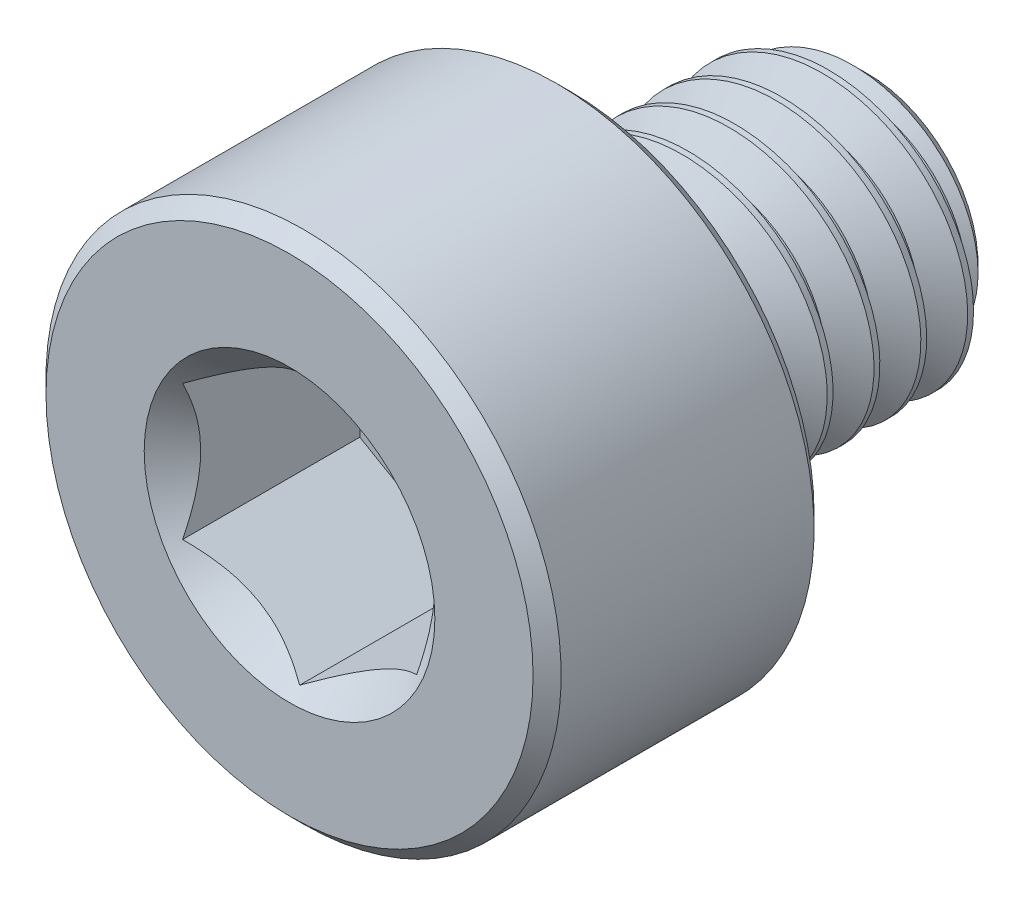
from build123d import *

# Parameters (mm, degrees)
CUT_EXTRUDE1_DEPTH     = 2
SKETCH4_R              = 1.551628848
CUT_EXTRUDE2_DEPTH     = 1.5
CUT_EXTRUDE2_DRAFT     = -45
SPLIT1_SURFACE_1_BACK  = 10.931
SPLIT1_SURFACE_1_DEPTH = 21.862
SPLIT1_SURFACE_2_BACK  = 10.931
SPLIT1_SURFACE_2_DEPTH = 21.862
CUT_SWEEP1_PITCH       = 0.5


with BuildPart() as part:
    # Sketch2 → Revolve1 (revolve)
    with BuildSketch(Plane(origin=(0, 0, 0), x_dir=(0, 0, -1), z_dir=(1, 0, 0))):
        with BuildLine():
            Line((-3.0875, 0), (-3.0875, 2.6))
            Line((-3.0875, 2.6), (-2.9375, 2.75))
            Line((-2.9375, 2.75), (-0.2375, 2.75))
            Line((-0.2375, 2.75), (-0.0875, 2.6))
            Line((-0.0875, 2.6), (-0.0875, 1.65))
            ThreePointArc((-0.0875, 1.65), (-0.043566017, 1.543933983), (0.0625, 1.5))
            Line((0.0625, 1.5), (2.762740474, 1.5))
            Line((2.762740474, 1.5), (3.0875, 1.175240474))
            Line((3.0875, 1.175240474), (3.0875, 0))
            Line((3.0875, 0), (-3.0875, 0))
        make_face()
    revolve(axis=Axis((0, 0, -3.0875), (0, 0, 1)))

    # Sketch3 → Cut-Extrude1 (cut)
    with BuildSketch(Plane.XY.offset(3.0875)):
        Polygon((1.25, -0.721687836), (1.25, 0.721687836), (0, 1.443375673), (-1.25, 0.721687836), (-1.25, -0.721687836), (0, -1.443375673), align=None)
    extrude(amount=-CUT_EXTRUDE1_DEPTH, mode=Mode.SUBTRACT)


with BuildPart() as cut_extrude2_tool:
    # Sketch4 → Cut-Extrude2 (with draft: the straight prism first)
    with BuildSketch(Plane.XY.offset(3.0875)):
        Circle(SKETCH4_R)
    extrude(amount=-CUT_EXTRUDE2_DEPTH)
    # Cut-Extrude2: the draft: its side faces are tilted about the plane it starts from
    cut_extrude2_sides = [cut_extrude2_tool.faces().sort_by_distance(p)[0] for p in [
        (-1.551628848, 0, 2.3375),
    ]]
    draft(cut_extrude2_sides, Plane.XY.offset(3.0875), CUT_EXTRUDE2_DRAFT)


with BuildPart() as part_1:
    add(part.part)

    # Cut-Extrude2: cut by cut_extrude2_tool
    add(cut_extrude2_tool.part, mode=Mode.SUBTRACT)


with BuildPart() as body_2:
    # Split1: the piece behind the surface
    add(part_1.part)
    # Split1 surface: a surface, the sketch's curves swept straight by 21.862 mm
    with BuildLine(Plane(origin=(0, 0, 0), x_dir=(0, 0, -1), z_dir=(1, 0, 0)).offset(-SPLIT1_SURFACE_1_BACK), mode=Mode.PRIVATE) as split1_surface_1_path:
        Line((0.0625, -2.75), (0.0625, 2.75))
    split1_surface_1 = Shell.extrude(split1_surface_1_path.wire(), (1 * SPLIT1_SURFACE_1_DEPTH, 0 * SPLIT1_SURFACE_1_DEPTH, 0 * SPLIT1_SURFACE_1_DEPTH))
    split(bisect_by=split1_surface_1, keep=Keep.BOTTOM)

    # Cut-Sweep1: the profile of Sketch7 screwed along a right-hand helix of 7.35 turns, 6 arcs to a turn; built about Z, then put on its axis
    cut_sweep1_z = Axis((0, 0, 0), (0, 0, 1))
    cut_sweep1_corners = [(1.527063294, 0, 0.015625), (1.527063294, 0, -0.453125), (1.175240474, 0, -0.25), (1.175240474, 0, -0.1875)]
    with BuildLine(mode=Mode.PRIVATE) as cut_sweep1_profile:
        Line(cut_sweep1_corners[0], cut_sweep1_corners[1])
        Line(cut_sweep1_corners[1], cut_sweep1_corners[2])
        Line(cut_sweep1_corners[2], cut_sweep1_corners[3])
        Line(cut_sweep1_corners[3], cut_sweep1_corners[0])
    cut_sweep1_cap = Face(cut_sweep1_profile.wire())
    cut_sweep1_turn_angles = [0, 30, 60, 90, 120, 150, 180, 210, 240, 270, 300, 330, 360]
    cut_sweep1_turn_weights = [1, 0.8660254037844387, 1, 0.8660254037844387, 1, 0.8660254037844387, 1, 0.8660254037844387, 1, 0.8660254037844387, 1, 0.8660254037844387, 1]
    cut_sweep1_turn_rails = [Edge.make_bspline([Vector(p[0], p[1], 0).rotate(cut_sweep1_z, cut_sweep1_turn_angles[k]) / cut_sweep1_turn_weights[k] + Vector(0, 0, p[2] + CUT_SWEEP1_PITCH * cut_sweep1_turn_angles[k] / 360) for k in range(13)], [0, 0, 0, 1, 1, 2, 2, 3, 3, 4, 4, 5, 5, 6, 6, 6], 2, cut_sweep1_turn_weights) for p in cut_sweep1_corners]
    cut_sweep1_turn_sides = [Face.make_surface_from_curves(cut_sweep1_turn_rails[p[0]], cut_sweep1_turn_rails[p[1]]) for p in [(0, 1), (1, 2), (2, 3), (3, 0)]]
    cut_sweep1_last_angles = [2520, 2550, 2580, 2610, 2640, 2643, 2646]
    cut_sweep1_last_weights = [1, 0.8660254037844387, 1, 0.8660254037844387, 1, 0.9986295347545747, 1]
    cut_sweep1_last_rails = [Edge.make_bspline([Vector(p[0], p[1], 0).rotate(cut_sweep1_z, cut_sweep1_last_angles[k]) / cut_sweep1_last_weights[k] + Vector(0, 0, p[2] + CUT_SWEEP1_PITCH * cut_sweep1_last_angles[k] / 360) for k in range(7)], [0, 0, 0, 1, 1, 2, 2, 3, 3, 3], 2, cut_sweep1_last_weights) for p in cut_sweep1_corners]
    cut_sweep1_last_sides = [Face.make_surface_from_curves(cut_sweep1_last_rails[p[0]], cut_sweep1_last_rails[p[1]]) for p in [(0, 1), (1, 2), (2, 3), (3, 0)]]
    cut_sweep1 = Plane(origin=(0, 0, -3.0875), x_dir=(0, 1, 0), z_dir=(0, 0, 1)) * Solid(Shell([*[p.moved(Location((0, 0, CUT_SWEEP1_PITCH * i))) for i in range(7) for p in cut_sweep1_turn_sides], *cut_sweep1_last_sides, cut_sweep1_cap, cut_sweep1_cap.rotate(cut_sweep1_z, 2646).moved(Location((0, 0, CUT_SWEEP1_PITCH * 2646 / 360)))]))
    add(cut_sweep1, mode=Mode.SUBTRACT)


with BuildPart() as part_2:
    add(part_1.part)

    # Split1: split by a surface, the side it looks to stays
    # Split1 surface: a surface, the sketch's curves swept straight by 21.862 mm
    with BuildLine(Plane(origin=(0, 0, 0), x_dir=(0, 0, -1), z_dir=(1, 0, 0)).offset(-SPLIT1_SURFACE_2_BACK), mode=Mode.PRIVATE) as split1_surface_2_path:
        Line((0.0625, -2.75), (0.0625, 2.75))
    split1_surface_2 = Shell.extrude(split1_surface_2_path.wire(), (1 * SPLIT1_SURFACE_2_DEPTH, 0 * SPLIT1_SURFACE_2_DEPTH, 0 * SPLIT1_SURFACE_2_DEPTH))
    split(bisect_by=split1_surface_2, keep=Keep.TOP)

    add(body_2.part)  # Revolve2 merges body 2
    # Sketch8 → Revolve2 (revolve)
    with BuildSketch(Plane(origin=(0, 0, 0), x_dir=(0, 0, -1), z_dir=(1, 0, 0))):
        Polygon((-0.0875, 0), (-0.0875, 1.5), (0.0625, 1.5), (0.928525404, 0), align=None)
    revolve(axis=Axis((0, 0, -0.928525404), (0, 0, 1)))


solid = part_2.part
